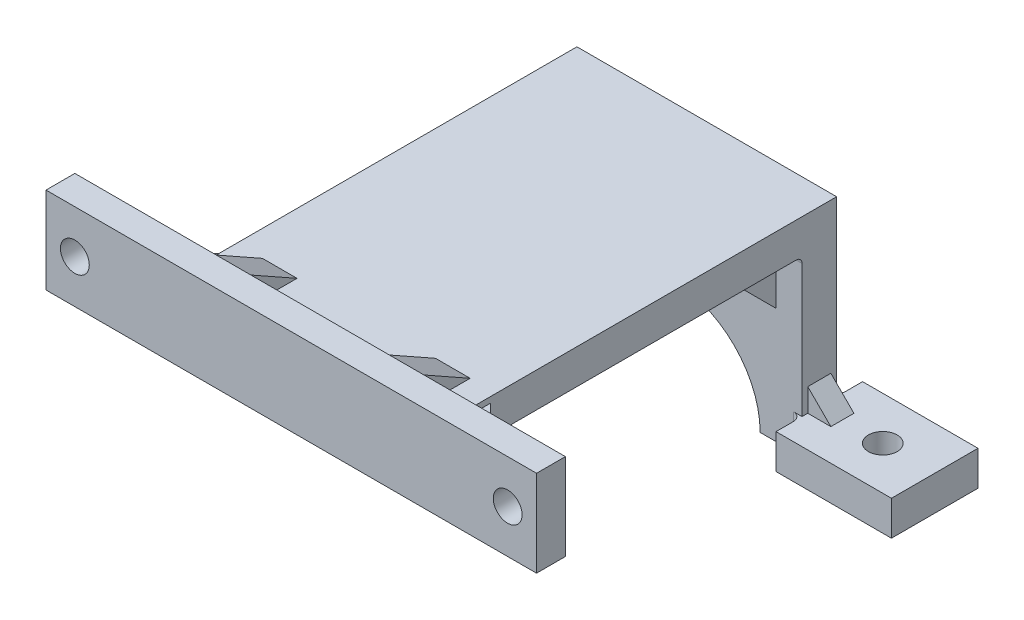
from build123d import *

# Parameters (mm, degrees)
SKETCH_1_W          = 85
SKETCH_1_H          = 15
EXTRUDE_1_DEPTH     = 5
SKETCH_2_R          = 2.5
CUT_EXTRUDE_1_DEPTH = 5
SKETCH_3_W          = 45
SKETCH_3_H          = 6
EXTRUDE_2_DEPTH     = 67
SKETCH_4_W          = 45
SKETCH_4_H          = 6
EXTRUDE_3_DEPTH     = 30
SKETCH_7_W          = 20
SKETCH_7_H          = 15
EXTRUDE_4_DEPTH     = 6
CUT_EXTRUDE_3_DEPTH = 6
EXTRUDE_5_DEPTH     = 3
EXTRUDE_6_DEPTH     = 3
FILLET_1_R          = 1
SKETCH_11_R         = 2.5
CUT_EXTRUDE_4_DEPTH = 6
FILLET_2_R          = 1.5
EXTRUDE_7_DEPTH     = 2
EXTRUDE_8_DEPTH     = 2
EXTRUDE_9_DEPTH     = 3
EXTRUDE_10_DEPTH    = 3


with BuildPart() as part:
    # 草图1 → 凸台-拉伸1 (new body)
    with BuildSketch(Plane.XY):
        Rectangle(SKETCH_1_W, SKETCH_1_H)
    extrude(amount=EXTRUDE_1_DEPTH)

    # 草图2 → 切除-拉伸1 (cut)
    with BuildSketch(Plane.XY.offset(5)):
        with Locations((-37.5, 0)):
            Circle(SKETCH_2_R)
        with Locations((37.5, 0)):
            Circle(SKETCH_2_R)
    extrude(amount=-CUT_EXTRUDE_1_DEPTH, mode=Mode.SUBTRACT)

    # 草图3 → 凸台-拉伸2 (add)
    with BuildSketch(Plane(origin=(0, 0, 0), x_dir=(-1, 0, 0), z_dir=(0, 0, -1))):
        Rectangle(SKETCH_3_W, SKETCH_3_H)
    extrude(amount=EXTRUDE_2_DEPTH)

    # 草图4 → 凸台-拉伸3 (add)
    with BuildSketch(Plane.XZ.offset(3)):
        with Locations((0, -64)):
            Rectangle(SKETCH_4_W, SKETCH_4_H)
    extrude(amount=EXTRUDE_3_DEPTH)

    # 草图7 → 凸台-拉伸4 (add)
    with BuildSketch(Plane.XZ.offset(33)):
        with Locations((32.5, -64)):
            Rectangle(SKETCH_7_W, SKETCH_7_H)
        with Locations((-32.5, -64)):
            Rectangle(SKETCH_7_W, SKETCH_7_H)
    extrude(amount=-EXTRUDE_4_DEPTH)

    # 草图5 → 切除-拉伸3 (cut)
    with BuildSketch(Plane(origin=(0, 0, -67), x_dir=(-1, 0, 0), z_dir=(0, 0, -1))):
        with BuildLine():
            Line((-15.25, -33), (15.25, -33))
            ThreePointArc((15.25, -33), (0, -17.75), (-15.25, -33))
        make_face()
    extrude(amount=-CUT_EXTRUDE_3_DEPTH, mode=Mode.SUBTRACT)

    # 草图8 → 凸台-拉伸5 (add, symmetric)
    with BuildSketch(Plane(origin=(15, 0, 0), x_dir=(0, 0, -1), z_dir=(1, 0, 0))):
        Polygon((51, -3), (61, -13), (61, -3), align=None)
    extrude(amount=EXTRUDE_5_DEPTH, both=True)

    # 草图10 → 凸台-拉伸6 (add, symmetric)
    with BuildSketch(Plane(origin=(-15, 0, 0), x_dir=(0, 0, -1), z_dir=(1, 0, 0))):
        Polygon((61, -3), (51, -3), (61, -13), align=None)
    extrude(amount=EXTRUDE_6_DEPTH, both=True)

    # 圆角1
    fillet_1_edges = [part.edges().sort_by_distance(p)[0] for p in [
        (-20.25, -3, -61),
        (20.25, -3, -61),
        (0, -3, -61),
    ]]
    fillet(fillet_1_edges, radius=FILLET_1_R)

    # 草图11 → 切除-拉伸4 (cut)
    with BuildSketch(Plane.XZ.offset(33)):
        with Locations((-33.5, -64)):
            Circle(SKETCH_11_R)
        with Locations(Location((33.5, -64, 0), (0, 0, 180))):
            Circle(SKETCH_11_R)
    extrude(amount=-CUT_EXTRUDE_4_DEPTH, mode=Mode.SUBTRACT)

    # 圆角2
    # the kernel refuses this fillet: 1.5 mm, written as the material it adds along each edge
    with BuildSketch(Plane(origin=(-22.5, -27, -67), x_dir=(1, 0, 0), z_dir=(0, -1, 0)), Plane(origin=(22.5, -27, -61), x_dir=(-1, 0, 0), z_dir=(0, -1, 0)), Plane(origin=(22.5, -33, -67), x_dir=(-1, 0, 0), z_dir=(0, 1, 0))) as fillet_2_piece_1:
        with BuildLine():
            CenterArc((FILLET_2_R, -FILLET_2_R), FILLET_2_R, 90, 90)
            Line((0, -FILLET_2_R), (0, 0))
            Line((0, 0), (FILLET_2_R, 0))
        make_face()
    extrude(amount=6)
    with BuildSketch(Plane(origin=(-22.5, -27, -61), x_dir=(1, 0, 0), z_dir=(0, -1, 0))) as fillet_2_piece_2:
        with BuildLine():
            CenterArc((FILLET_2_R, FILLET_2_R), FILLET_2_R, 180, 90)
            Line((0, FILLET_2_R), (0, 0))
            Line((0, 0), (FILLET_2_R, 0))
        make_face()
    extrude(amount=6)

    # 草图12 → 凸台-拉伸7 (add, symmetric)
    with BuildSketch(Plane(origin=(0, 0, -64), x_dir=(-1, 0, 0), z_dir=(0, 0, -1))):
        Polygon((-22.5, -23), (-26.5, -27), (-22.5, -27), align=None)
    extrude_7 = extrude(amount=EXTRUDE_7_DEPTH, both=True)

    # 镜向1: 凸台-拉伸7 across plane
    add(extrude_7.mirror(Plane(origin=(0, 0, 0), x_dir=(0, 0, 1), z_dir=(1, 0, 0))))

    # 草图13 → 凸台-拉伸8 (add, symmetric)
    with BuildSketch(Plane(origin=(0, 0, 0), x_dir=(-1, 0, 0), z_dir=(0, -1, 0))):
        Polygon((-22.5, 7), (-29.5, 0), (-22.5, 0), align=None)
    extrude_8 = extrude(amount=EXTRUDE_8_DEPTH, both=True)

    # 镜向2: 凸台-拉伸8 across plane
    add(extrude_8.mirror(Plane(origin=(0, 0, 0), x_dir=(0, 0, 1), z_dir=(1, 0, 0))))

    # 草图14 → 凸台-拉伸9 (add, symmetric)
    with BuildSketch(Plane(origin=(15, 0, 0), x_dir=(0, 0, -1), z_dir=(1, 0, 0))):
        Polygon((0, 7.5), (8, 3), (0, 3), align=None)
        Polygon((8, -3), (0, -3), (0, -7.5), align=None)
    extrude(amount=EXTRUDE_9_DEPTH, both=True)

    # 草图15 → 凸台-拉伸10 (add, symmetric)
    with BuildSketch(Plane(origin=(-15, 0, 0), x_dir=(0, 0, -1), z_dir=(1, 0, 0))):
        Polygon((0, -7.5), (8, -3), (0, -3), align=None)
        Polygon((0, 7.5), (0, 3), (8, 3), align=None)
    extrude(amount=EXTRUDE_10_DEPTH, both=True)


solid = part.part
